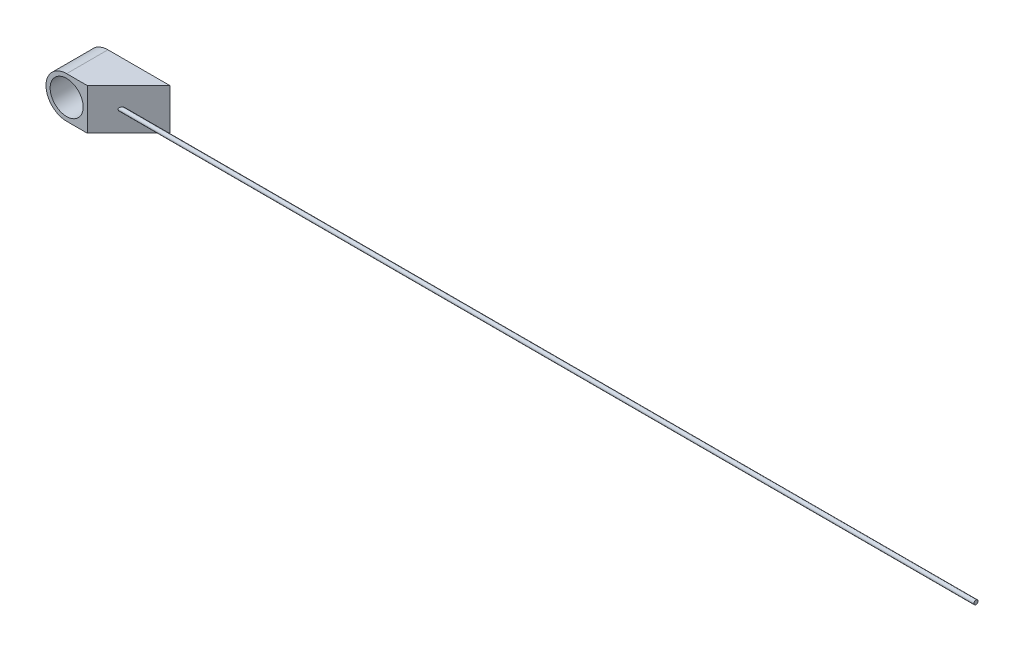
from build123d import *

# Parameters (mm, degrees)
SZKIC1_R                    = 5
SZKIC1_R_2                  = 4
DODANIE_WYCI_GNI_CIE1_DEPTH = 10
SZKIC2_W                    = 10
SZKIC2_H                    = 10
DODANIE_WYCI_GNI_CIE2_DEPTH = 10
DODANIE_WYCI_GNI_CIE3_DEPTH = 10
DODANIE_WYCI_GNI_CIE4_DEPTH = 10
SFAZOWANIE1_SIZE            = 10
DODANIE_WYCI_GNI_CIE6_START = 6
SZKIC6_R                    = 0.5
DODANIE_WYCI_GNI_CIE6_DEPTH = 210


with BuildPart() as part:
    # Szkic1 → Dodanie-wyciągnięcie1 (new body)
    with BuildSketch(Plane.XY):
        Circle(SZKIC1_R)
        Circle(SZKIC1_R_2, mode=Mode.SUBTRACT)
    extrude(amount=DODANIE_WYCI_GNI_CIE1_DEPTH)



with BuildPart() as body_2:
    # Szkic2 → Dodanie-wyciągnięcie2 (new body)
    with BuildSketch(Plane.XY.offset(10)):
        with Locations((10, 0)):
            Rectangle(SZKIC2_W, SZKIC2_H)
    extrude(amount=-DODANIE_WYCI_GNI_CIE2_DEPTH)


with BuildPart() as part_1:
    add(part.part)

    add(body_2.part)  # Dodanie-wyciągnięcie3 merges body 2
    # Szkic3 → Dodanie-wyciągnięcie3 (add)
    with BuildSketch(Plane.XY):
        Polygon((0, 5), (5, 5), (5, 0), (3.357304053, 3.705200331), align=None)
    extrude(amount=DODANIE_WYCI_GNI_CIE3_DEPTH)

    # Szkic5 → Dodanie-wyciągnięcie4 (add)
    with BuildSketch(Plane(origin=(0, 0, 0), x_dir=(-1, 0, 0), z_dir=(0, 0, -1))):
        Polygon((-5, -5), (-5, 0), (-3.105231781, -3.918869172), (0, -5), align=None)
    extrude(amount=-DODANIE_WYCI_GNI_CIE4_DEPTH)

    # Sfazowanie1
    sfazowanie1_edges = [part_1.edges().sort_by_distance(p)[0] for p in [
        (15, 0, 10),
    ]]
    chamfer(sfazowanie1_edges, length=SFAZOWANIE1_SIZE - 0.0001)  # a hair under: the kernel refuses the full size

    # Szkic6 → Dodanie-wyciągnięcie6 (add)
    with BuildSketch(Plane(origin=(0, 0, 0), x_dir=(0, 0, -1), z_dir=(1, 0, 0)).offset(DODANIE_WYCI_GNI_CIE6_START)):
        with Locations(Location((-5.785366317, 0, 0), (0, 0, 180))):
            Circle(SZKIC6_R)
    extrude(amount=DODANIE_WYCI_GNI_CIE6_DEPTH)


solid = part_1.part
